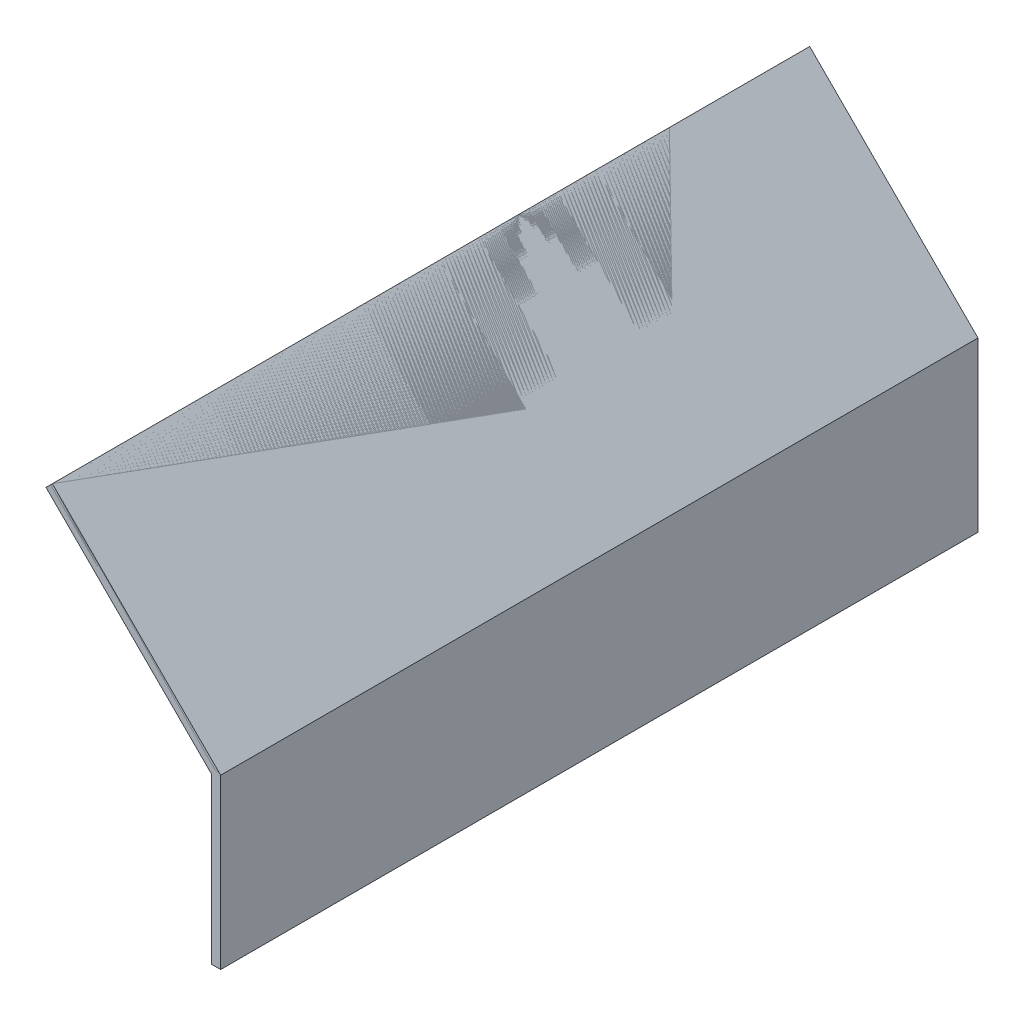
from build123d import *

# Parameters (mm, degrees)
BOSS_EXTRUDE2_DEPTH  = 342.9
CONVERT_SOLID2_START = -342.9
CONVERT_SOLID2_DEPTH = 342.9
SKETCH12_W           = 73.025
SKETCH12_H           = 76.927581903
CUT_EXTRUDE1_DEPTH   = 292.1
SKETCH13_W           = 85.725
SKETCH13_H           = 76.927581903
CUT_EXTRUDE2_DEPTH   = 292.1
SKETCH14_R           = 3.2639
CUT_EXTRUDE3_DEPTH   = 292.1
SKETCH18_W           = 50.8
SKETCH18_H           = 76.927581903
CUT_EXTRUDE4_DEPTH   = 439.772530417
SKETCH21_W           = 63.5
SKETCH21_H           = 100.852216804
CUT_EXTRUDE11_DEPTH  = 439.772530417


# Read off the part's stored shape, not the designer's step: Convert-Solid2
with BuildPart() as part:
    # Sketch7 → Boss-Extrude2 (new body)
    with BuildSketch(Plane.XY):
        Polygon((0, 0), (4.064, 0), (4.064, 76.2), (-72.136, 152.4), (-75.009681959, 149.526318041), (-74.603697881, 149.120333963), (0, 74.516636083), align=None)
    extrude(amount=-BOSS_EXTRUDE2_DEPTH)


with BuildPart() as body_2:
    # Convert-Solid2 outline → Convert-Solid2 (new body)
    with BuildSketch(Plane.XY.offset(CONVERT_SOLID2_START)):
        with BuildLine():
            Line((2.84988, 0), (4.064, 0))
            Line((4.064, 0), (4.064, 75.171043805))
            ThreePointArc((4.064, 75.171043805), (3.874907624, 76.121675373), (3.336418097, 76.927581903))
            Line((3.336418097, 76.927581903), (-72.136, 152.4))
            Line((-72.136, 152.4), (-72.994512485, 151.541487515))
            Line((-72.994512485, 151.541487515), (2.477905612, 76.069069418))
            ThreePointArc((2.477905612, 76.069069418), (2.753207006, 75.657051765), (2.84988, 75.171043805))
            Line((2.84988, 75.171043805), (2.84988, 0))
        make_face()
    extrude(amount=CONVERT_SOLID2_DEPTH)

    # Sketch12 → Cut-Extrude1 (cut)
    with BuildSketch(Plane(origin=(152.4, 0, 0), x_dir=(0, 0, -1), z_dir=(1, 0, 0))):
        with Locations((36.5125, 38.463790952)):
            Rectangle(SKETCH12_W, SKETCH12_H)
    extrude(amount=-CUT_EXTRUDE1_DEPTH, mode=Mode.SUBTRACT)

    # Sketch13 → Cut-Extrude2 (cut)
    with BuildSketch(Plane(origin=(152.4, 0, 0), x_dir=(0, 0, -1), z_dir=(1, 0, 0))):
        with Locations((249.2375, 38.463790952)):
            Rectangle(SKETCH13_W, SKETCH13_H)
    extrude(amount=-CUT_EXTRUDE2_DEPTH, mode=Mode.SUBTRACT)

    # Sketch14 → Cut-Extrude3 (cut)
    with BuildSketch(Plane.ZY.offset(-2.84988)):
        with Locations(Location((-193.675, 12.7, 0), (0, 0, 270))):
            Circle(SKETCH14_R)
        with Locations(Location((-85.725, 12.7, 0), (0, 0, 270))):
            Circle(SKETCH14_R)
    extrude(amount=-CUT_EXTRUDE3_DEPTH, mode=Mode.SUBTRACT)

    # Sketch18 → Cut-Extrude4 (cut, through all)
    with BuildSketch(Plane(origin=(152.4, 0, 0), x_dir=(0, 0, -1), z_dir=(1, 0, 0))):
        with Locations((317.5, 38.463790952)):
            Rectangle(SKETCH18_W, SKETCH18_H)
    extrude(amount=-CUT_EXTRUDE4_DEPTH, mode=Mode.SUBTRACT)

    # Sketch21 → Cut-Extrude11 (cut, through all)
    with BuildSketch(Plane(origin=(152.4, 0, 0), x_dir=(0, 0, -1), z_dir=(1, 0, 0))):
        with Locations((311.15, 127.353690305)):
            Rectangle(SKETCH21_W, SKETCH21_H)
    extrude(amount=-CUT_EXTRUDE11_DEPTH, mode=Mode.SUBTRACT)


solid = Compound([part.part, body_2.part])
